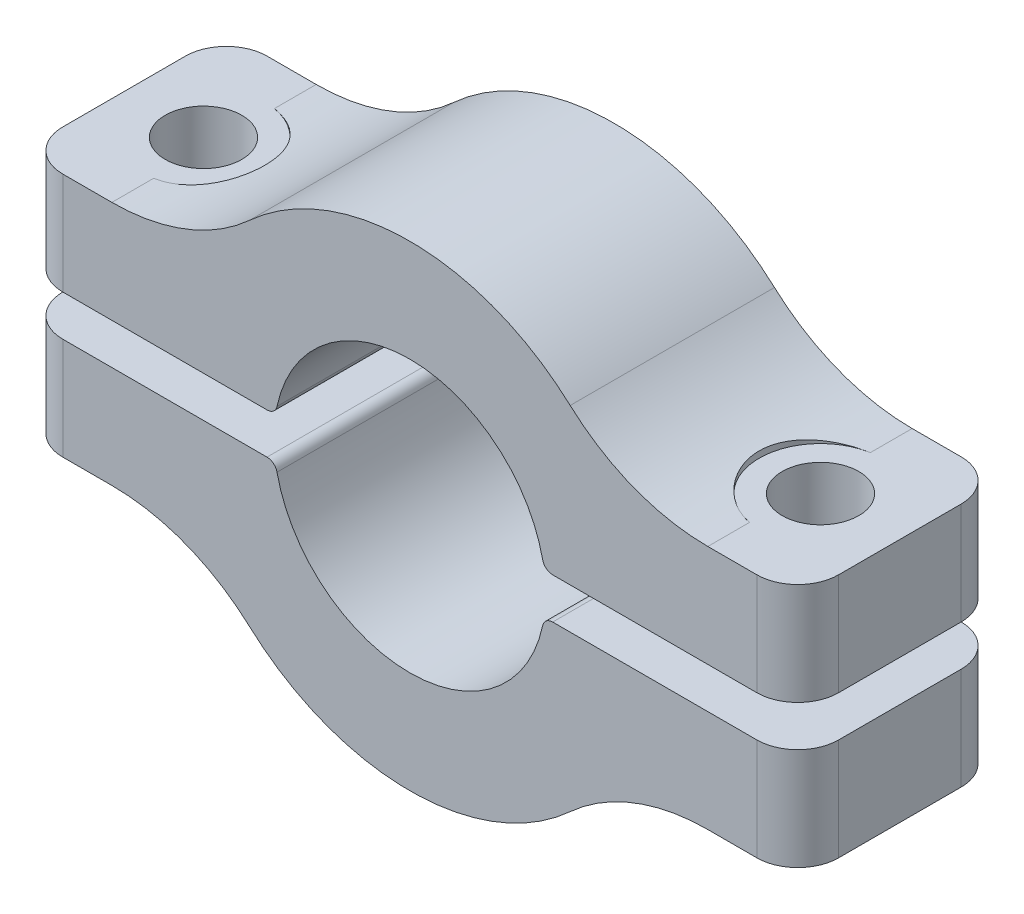
from build123d import *

# Parameters (mm, degrees)
BOSS_EXTRUDE1_DEPTH = 10
FILLET1_R           = 2
FILLET3_R           = 0.5
FILLET4_R           = 10
SKETCH2_R           = 1.875
CUT_EXTRUDE1_DEPTH  = 25.417106227
CUT_EXTRUDE2_START  = 6
SKETCH3_R           = 3
CUT_EXTRUDE2_DEPTH  = 10


with BuildPart() as part:
    # Sketch1 → Boss-Extrude1 (new body)
    with BuildSketch(Plane.XY):
        with BuildLine():
            Line((-18.986115361, 1), (-6.5743821, 1))
            ThreePointArc((-6.5743821, 1), (0, 6.65), (6.5743821, 1))
            Line((6.5743821, 1), (18.986115361, 1))
            Line((18.986115361, 1), (18.986115361, 6))
            Line((18.986115361, 6), (9.986115361, 6))
            ThreePointArc((9.986115361, 6), (0, 11.65), (-9.986115361, 6))
            Line((-9.986115361, 6), (-18.986115361, 6))
            Line((-18.986115361, 6), (-18.986115361, 1))
        make_face()
    extrude(amount=BOSS_EXTRUDE1_DEPTH)

    # Fillet1
    fillet1_edges = [part.edges().sort_by_distance(p)[0] for p in [
        (18.986115361, 3.5, 0),
        (-18.986115361, 3.5, 0),
        (18.986115361, 3.5, 10),
        (-18.986115361, 3.5, 10),
    ]]
    fillet(fillet1_edges, radius=FILLET1_R)

    # Fillet3
    fillet3_edges = [part.edges().sort_by_distance(p)[0] for p in [
        (-6.5743821, 1, 5),
        (6.5743821, 1, 5),
    ]]
    fillet(fillet3_edges, radius=FILLET3_R)

    # Fillet4
    fillet4_edges = [part.edges().sort_by_distance(p)[0] for p in [
        (9.986115361, 6, 5),
        (-9.986115361, 6, 5),
    ]]
    fillet(fillet4_edges, radius=FILLET4_R)

    # Sketch2 → Cut-Extrude1 (cut, through all)
    with BuildSketch(Plane(origin=(0, 0, 0), x_dir=(1, 0, 0), z_dir=(0, 1, 0))):
        with Locations((-15.1, -5)):
            Circle(SKETCH2_R)
        with Locations((15.1, -5)):
            Circle(SKETCH2_R)
    extrude(amount=CUT_EXTRUDE1_DEPTH, mode=Mode.SUBTRACT)

    # Sketch3 → Cut-Extrude2 (cut)
    with BuildSketch(Plane(origin=(0, 0, 0), x_dir=(1, 0, 0), z_dir=(0, 1, 0)).offset(CUT_EXTRUDE2_START)):
        with Locations((-15.1, -5)):
            Circle(SKETCH3_R)
        with Locations((15.1, -5)):
            Circle(SKETCH3_R)
    extrude(amount=CUT_EXTRUDE2_DEPTH, mode=Mode.SUBTRACT)


with BuildPart() as body_2:
    # Mirror3: mirrored copy
    add(part.part.mirror(Plane.ZX))


solid = Compound([part.part, body_2.part])
